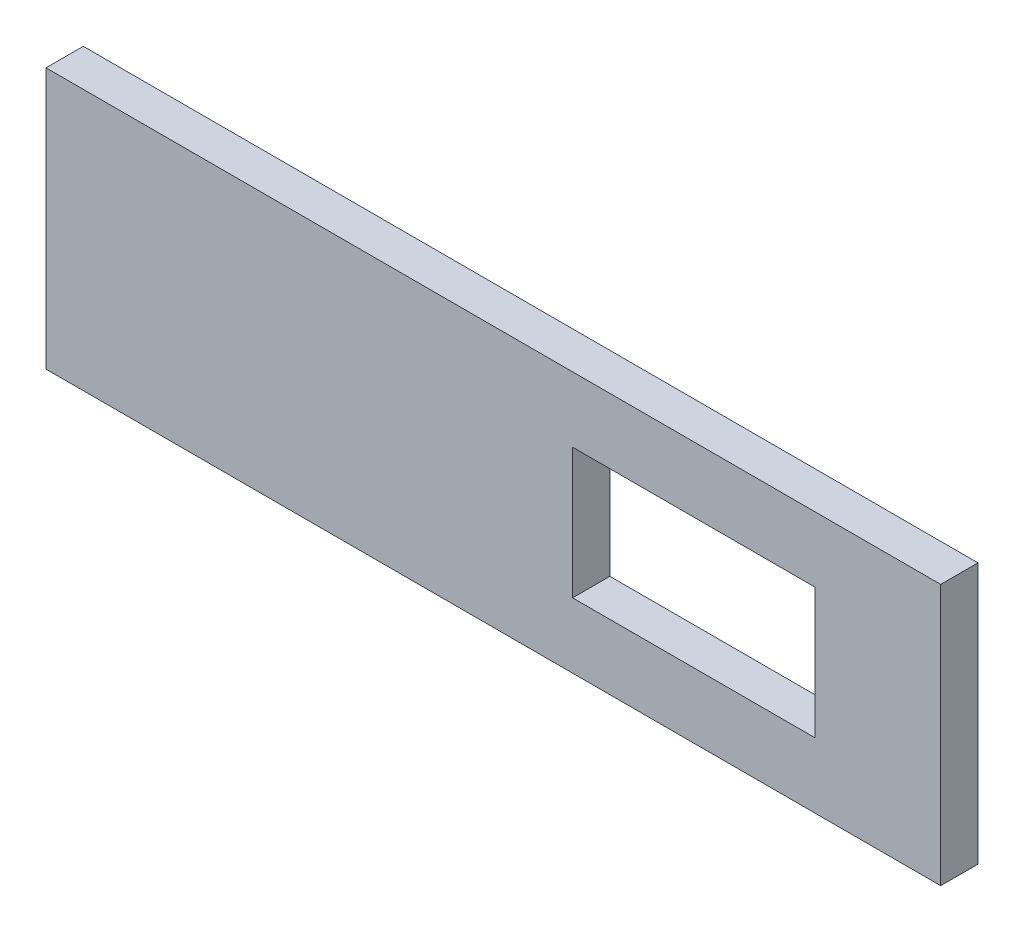
from build123d import *

# Parameters (mm, degrees)
SKETCH1_W           = 152.4
SKETCH1_H           = 44.45
BOSS_EXTRUDE1_DEPTH = 6.35
SKETCH2_W           = 41.275
SKETCH2_H           = 22.225
CUT_EXTRUDE1_DEPTH  = 113.728186422


with BuildPart() as part:
    # Sketch1 → Boss-Extrude1 (new body)
    with BuildSketch(Plane.XY):
        with Locations((-34.133, 0)):
            Rectangle(SKETCH1_W, SKETCH1_H)
    extrude(amount=BOSS_EXTRUDE1_DEPTH)

    # Sketch2 → Cut-Extrude1 (cut, through all)
    with BuildSketch(Plane.XY.offset(6.35)):
        Rectangle(SKETCH2_W, SKETCH2_H)
    extrude(amount=-CUT_EXTRUDE1_DEPTH, mode=Mode.SUBTRACT)


solid = part.part
